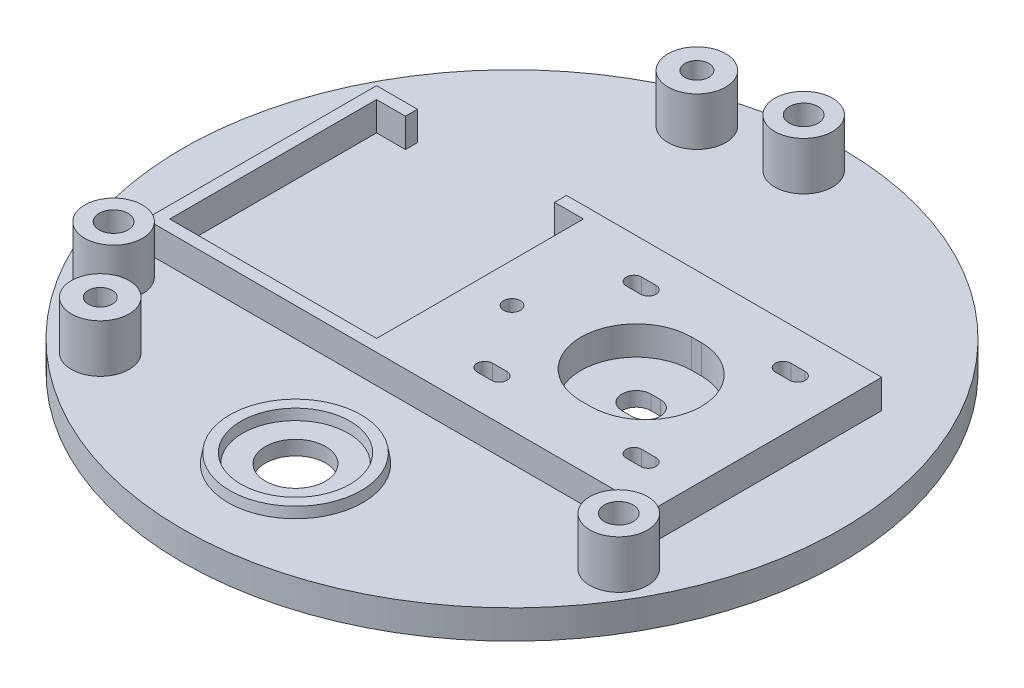
from build123d import *

# Parameters (mm, degrees)
SKETCH2_R           = 6
SKETCH2_R_2         = 3
SKETCH2_R_3         = 2.5
BOSS_EXTRUDE1_DEPTH = 10
SKETCH3_R           = 6.25
CUT_EXTRUDE1_DEPTH  = 10
SKETCH4_R           = 14
SKETCH4_R_2         = 11
BOSS_EXTRUDE2_DEPTH = 2
BOSS_EXTRUDE2_DRAFT = 10
BOSS_EXTRUDE3_DEPTH = 6
CUT_EXTRUDE2_DEPTH  = 98.614035876
CUT_EXTRUDE3_DEPTH  = 98.388397666
SKETCH8_R           = 1.75
CUT_EXTRUDE4_DEPTH  = 98.614035876


with BuildPart() as part:
    # Sketch1 → Revolve1 (revolve)
    with BuildSketch(Plane.XY):
        with BuildLine():
            Line((0, 0), (68.5, 0))
            Line((68.5, 0), (68.5, -6))
            Line((68.5, -6), (66.5, -6))
            Line((66.5, -6), (66.5, -3))
            Line((66.5, -3), (62.351595203, -3))
            ThreePointArc((62.351595203, -3), (60, -2.3), (57.648404797, -3))
            Line((57.648404797, -3), (53.5, -3))
            Line((53.5, -3), (53.5, -6))
            Line((53.5, -6), (50.5, -6))
            Line((50.5, -6), (50.5, -3))
            Line((50.5, -3), (6, -3))
            Line((6, -3), (6, -5))
            Line((6, -5), (0, -5))
            Line((0, -5), (0, 0))
        make_face()
    revolve(axis=Axis((0, -5, 0), (0, 1, 0)))

    # Sketch2 → Boss-Extrude1 (add)
    # profile 1 of 5: a face of its own
    with BuildSketch(Plane(origin=(0, 0, 0), x_dir=(1, 0, 0), z_dir=(0, 1, 0))):
        with Locations((0, 60.621778265)):
            Circle(SKETCH2_R)
        with Locations((0, 60.621778265)):
            Circle(SKETCH2_R_2, mode=Mode.SUBTRACT)
    # profile 2 of 5: a face of its own
    with BuildSketch(Plane(origin=(0, 0, 0), x_dir=(1, 0, 0), z_dir=(0, 1, 0))):
        with Locations((52.5, -30.310889132)):
            Circle(SKETCH2_R)
        with Locations((52.5, -30.310889132)):
            Circle(SKETCH2_R_2, mode=Mode.SUBTRACT)
    # profile 3 of 5: a face of its own
    with BuildSketch(Plane(origin=(0, 0, 0), x_dir=(1, 0, 0), z_dir=(0, 1, 0))):
        with Locations((-52.5, -30.310889132)):
            Circle(SKETCH2_R)
        with Locations((-52.5, -30.310889132)):
            Circle(SKETCH2_R_2, mode=Mode.SUBTRACT)
    # profile 4 of 5: a face of its own
    with BuildSketch(Plane(origin=(0, 0, 0), x_dir=(1, 0, 0), z_dir=(0, 1, 0))):
        with Locations((-40.273109217, -45.310889132)):
            Circle(SKETCH2_R)
        with Locations((-40.273109217, -45.310889132)):
            Circle(SKETCH2_R_3, mode=Mode.SUBTRACT)
    # profile 5 of 5: a face of its own
    with BuildSketch(Plane(origin=(0, 0, 0), x_dir=(1, 0, 0), z_dir=(0, 1, 0))):
        with Locations((-19.103826448, 57.532980238)):
            Circle(SKETCH2_R)
        with Locations((-19.103826448, 57.532980238)):
            Circle(SKETCH2_R_3, mode=Mode.SUBTRACT)
    extrude(amount=BOSS_EXTRUDE1_DEPTH)

    # Sketch3 → Cut-Extrude1 (cut)
    with BuildSketch(Plane(origin=(0, 0, 0), x_dir=(1, 0, 0), z_dir=(0, 1, 0))):
        with Locations((0, -45)):
            Circle(SKETCH3_R)
    extrude(amount=-CUT_EXTRUDE1_DEPTH, mode=Mode.SUBTRACT)


with BuildPart() as boss_extrude2_tool:
    # Sketch4 → Boss-Extrude2 (with draft: the straight prism first)
    with BuildSketch(Plane(origin=(0, 0, 0), x_dir=(1, 0, 0), z_dir=(0, 1, 0))):
        with Locations((0, -45)):
            Circle(SKETCH4_R)
        with Locations((0, -45)):
            Circle(SKETCH4_R_2, mode=Mode.SUBTRACT)
    extrude(amount=BOSS_EXTRUDE2_DEPTH)
    # Boss-Extrude2: the draft: its side faces are tilted about the plane it starts from
    boss_extrude2_sides = [boss_extrude2_tool.faces().sort_by_distance(p)[0] for p in [
        (-14, 1, 45),
        (-11, 1, 45),
    ]]
    draft(boss_extrude2_sides, Plane(origin=(0, 0, 0), x_dir=(1, 0, 0), z_dir=(0, 1, 0)), BOSS_EXTRUDE2_DRAFT)


with BuildPart() as part_1:
    add(part.part)

    # Boss-Extrude2: add boss_extrude2_tool
    add(boss_extrude2_tool.part)

    # Sketch5 → Boss-Extrude3 (add)
    with BuildSketch(Plane(origin=(0, 0, 0), x_dir=(1, 0, 0), z_dir=(0, 1, 0))):
        Polygon((51.356277967, -22.510312898), (51.356277967, 25.489687102), (-14.143722033, 25.489687102), (-14.143722033, 22.989687102), (-8.143722033, 22.989687102), (-8.143722033, -20.010312898), (-51.143722033, -20.010312898), (-51.143722033, 22.989687102), (-45.143722033, 22.989687102), (-45.143722033, 25.489687102), (-53.643722033, 25.489687102), (-53.643722033, -22.510312898), align=None)
        with BuildLine():
            Line((26.356277967, -10.010312898), (24.356277967, -10.010312898))
            ThreePointArc((24.356277967, -10.010312898), (12.856277967, 1.489687102), (24.356277967, 12.989687102))
            Line((24.356277967, 12.989687102), (26.356277967, 12.989687102))
            ThreePointArc((26.356277967, 12.989687102), (37.856277967, 1.489687102), (26.356277967, -10.010312898))
        make_face(mode=Mode.SUBTRACT)
    extrude(amount=BOSS_EXTRUDE3_DEPTH)

    # Sketch6 → Cut-Extrude2 (cut, through all)
    with BuildSketch(Plane(origin=(0, 6, 0), x_dir=(1, 0, 0), z_dir=(0, 1, 0))):
        with BuildLine():
            Line((11.356277967, -15.610312898), (8.356277967, -15.610312898))
            ThreePointArc((8.356277967, -15.610312898), (6.756277967, -14.010312898), (8.356277967, -12.410312898))
            Line((8.356277967, -12.410312898), (11.356277967, -12.410312898))
            ThreePointArc((11.356277967, -12.410312898), (12.956277967, -14.010312898), (11.356277967, -15.610312898))
        make_face()
        with BuildLine():
            Line((42.356277967, -15.610312898), (39.356277967, -15.610312898))
            ThreePointArc((39.356277967, -15.610312898), (37.756277967, -14.010312898), (39.356277967, -12.410312898))
            Line((39.356277967, -12.410312898), (42.356277967, -12.410312898))
            ThreePointArc((42.356277967, -12.410312898), (43.956277967, -14.010312898), (42.356277967, -15.610312898))
        make_face()
        with BuildLine():
            Line((42.356277967, 15.389687102), (39.356277967, 15.389687102))
            ThreePointArc((39.356277967, 15.389687102), (37.756277967, 16.989687102), (39.356277967, 18.589687102))
            Line((39.356277967, 18.589687102), (42.356277967, 18.589687102))
            ThreePointArc((42.356277967, 18.589687102), (43.956277967, 16.989687102), (42.356277967, 15.389687102))
        make_face()
        with BuildLine():
            Line((11.356277967, 15.389687102), (8.356277967, 15.389687102))
            ThreePointArc((8.356277967, 15.389687102), (6.756277967, 16.989687102), (8.356277967, 18.589687102))
            Line((8.356277967, 18.589687102), (11.356277967, 18.589687102))
            ThreePointArc((11.356277967, 18.589687102), (12.956277967, 16.989687102), (11.356277967, 15.389687102))
        make_face()
    extrude(amount=-CUT_EXTRUDE2_DEPTH, mode=Mode.SUBTRACT)

    # Sketch7 → Cut-Extrude3 (cut, through all)
    with BuildSketch(Plane(origin=(0, 0, 0), x_dir=(1, 0, 0), z_dir=(0, 1, 0))):
        with BuildLine():
            Line((26.356277967, -1.510312898), (24.356277967, -1.510312898))
            ThreePointArc((24.356277967, -1.510312898), (21.356277967, 1.489687102), (24.356277967, 4.489687102))
            Line((24.356277967, 4.489687102), (26.356277967, 4.489687102))
            ThreePointArc((26.356277967, 4.489687102), (29.356277967, 1.489687102), (26.356277967, -1.510312898))
        make_face()
    extrude(amount=-CUT_EXTRUDE3_DEPTH, mode=Mode.SUBTRACT)

    # Sketch8 → Cut-Extrude4 (cut, through all)
    with BuildSketch(Plane(origin=(0, 6, 0), x_dir=(1, 0, 0), z_dir=(0, 1, 0))):
        Circle(SKETCH8_R)
    extrude(amount=-CUT_EXTRUDE4_DEPTH, mode=Mode.SUBTRACT)


solid = part_1.part
